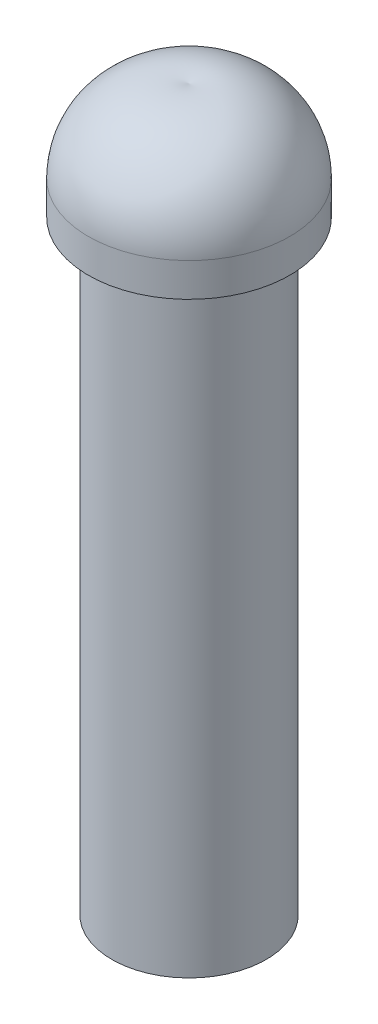
from build123d import *


with BuildPart() as part:
    # Sketch1 → Revolve1 (revolve)
    with BuildSketch(Plane.XY):
        with BuildLine():
            Line((-3, 13.11209092), (-2.3, 13.11209092))
            Line((-2.3, 13.11209092), (-2.3, -4.88790908))
            Line((-2.3, -4.88790908), (-1.55, -4.88790908))
            Line((-1.55, -4.88790908), (-1.55, 2.262295082))
            Line((-1.55, 2.262295082), (0, 2.262295082))
            Line((0, 2.262295082), (0, 16.561580663))
            ThreePointArc((0, 16.561580663), (-2.08113883, 16.048582593), (-3, 14.11209092))
            Line((-3, 14.11209092), (-3, 13.11209092))
        make_face()
    revolve(axis=Axis((0, 16.561580663, 0), (0, -1, 0)))


solid = part.part
